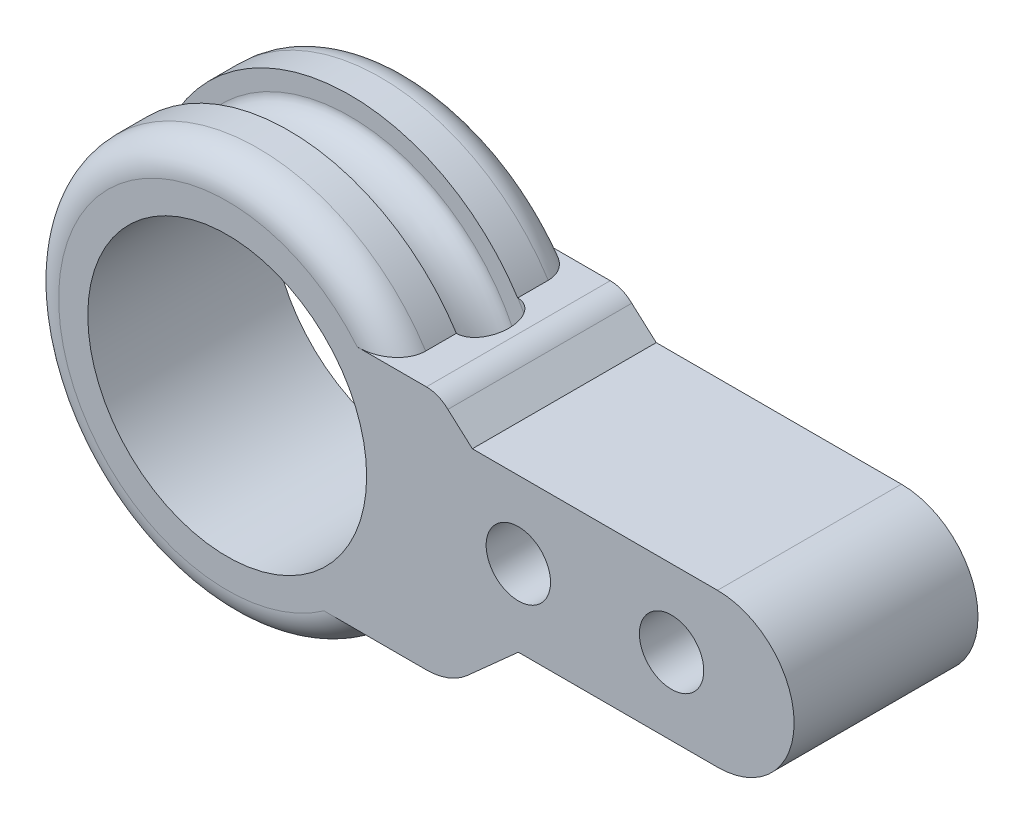
from build123d import *

# Parameters (mm, degrees)
BOSS_EXTRUDE1_DEPTH = 6
SKETCH1_5_R         = 4.55
CUT_EXTRUDE2_DEPTH  = 21.506096654
SKETCH1_6_R         = 1.05
CUT_EXTRUDE3_DEPTH  = 21.506096654
FILLET1_R           = 1


with BuildPart() as part:
    # Sketch1 → Boss-Extrude1 (new body)
    with BuildSketch(Plane.XY):
        with BuildLine():
            Line((9.5, -2.5), (16, -2.5))
            ThreePointArc((16, -2.5), (18.5, 0), (16, 2.5))
            Line((16, 2.5), (8, 2.5))
            Line((8, 2.5), (7.201136344, 3.213027227))
            ThreePointArc((7.201136344, 3.213027227), (6.878795969, 3.425480207), (6.5, 3.5))
            Line((6.5, 3.5), (5.477225575, 3.5))
            ThreePointArc((5.477225575, 3.5), (-6.468789112, 0.636213346), (4.69041576, -4.5))
            Line((4.69041576, -4.5), (6.5, -4.5))
            ThreePointArc((6.5, -4.5), (7.21364418, -4.368344718), (7.833333333, -3.990711985))
            Line((7.833333333, -3.990711985), (9.5, -2.5))
        make_face()
    extrude(amount=BOSS_EXTRUDE1_DEPTH)

    # Sketch1<5> → Cut-Extrude2 (cut, through all)
    with BuildSketch(Plane.XY):
        Circle(SKETCH1_5_R)
    extrude(amount=CUT_EXTRUDE2_DEPTH, mode=Mode.SUBTRACT)

    # Sketch1<6> → Cut-Extrude3 (cut, through all)
    with BuildSketch(Plane.XY):
        with Locations((14.5, 0)):
            Circle(SKETCH1_6_R)
        with Locations((9.5, 0)):
            Circle(SKETCH1_6_R)
    extrude(amount=CUT_EXTRUDE3_DEPTH, mode=Mode.SUBTRACT)

    # Sketch5 → Cut-Revolve2 (revolve, cut)
    with BuildSketch(Plane(origin=(0, 0, 0), x_dir=(0, 0, -1), z_dir=(1, 0, 0))):
        with BuildLine():
            Line((-3.998431193, 6.509033472), (-3.998431193, 5.899033472))
            add(Edge.make_bspline(
                [(-3.998431193, 5.899033472), (-3.998431193, 5.299033472), (-2.998431193, 5.299033472), (-1.998431193, 5.299033472), (-1.998431193, 5.899033472)],
                knots=[0, 0, 0, 1.570796327, 1.570796327, 3.141592654, 3.141592654, 3.141592654], degree=2, weights=[1, 0.707106781, 1, 0.707106781, 1]))
            Line((-1.998431193, 5.899033472), (-1.998431193, 6.509033472))
            add(Edge.make_bspline(
                [(-1.998431193, 6.509033472), (-1.998431193, 7.109033472), (-2.998431193, 7.109033472), (-3.998431193, 7.109033472), (-3.998431193, 6.509033472)],
                knots=[3.141592654, 3.141592654, 3.141592654, 4.71238898, 4.71238898, 6.283185307, 6.283185307, 6.283185307], degree=2, weights=[1, 0.707106781, 1, 0.707106781, 1]))
        make_face()
    revolve(axis=Axis((0, 0, 6.969963605), (0, 0, -1)), mode=Mode.SUBTRACT)

    # Fillet1
    fillet1_edges = [part.edges().sort_by_distance(p)[0] for p in [
        (-6.468789112, 0.636213346, 6),
        (-6.468789112, 0.636213346, 0),
    ]]
    fillet(fillet1_edges, radius=FILLET1_R)


solid = part.part
